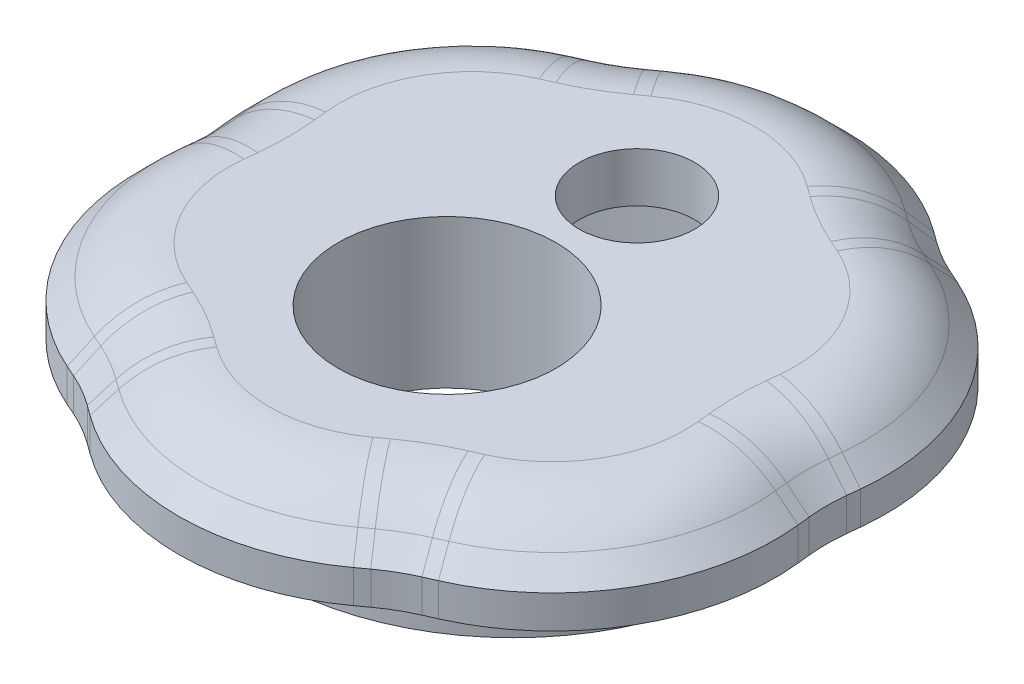
from build123d import *

# Parameters (mm, degrees)
EXTRUDE_1_DEPTH     = 3
CHAMFER_1_SIZE      = 4.5
SKETCH_3_R          = 14.75
SKETCH_3_R_2        = 14
EXTRUDE_2_DEPTH     = 6
FILLET_1_R          = 6
SKETCH_4_R          = 6.6
SKETCH_4_R_2        = 3.5
CUT_EXTRUDE_1_DEPTH = 10
SKETCH_5_R          = 7.5
SKETCH_5_R_2        = 6.6
EXTRUDE_3_DEPTH     = 6
EXTRUDE_4_DEPTH     = 2


with BuildPart() as part:
    # 草圖1 → 填料-伸長1 (new body)
    with BuildSketch(Plane(origin=(0, 0, 0), x_dir=(1, 0, 0), z_dir=(0, 1, 0))):
        with BuildLine():
            Line((-20.771924176, 1.723359404), (-20.69017274, 0.970783701))
            ThreePointArc((-20.69017274, 0.970783701), (-20.637537093, -0.00115824), (-20.69017274, -0.973100181))
            Line((-20.69017274, -0.973100181), (-20.771924176, -1.725675885))
            ThreePointArc((-20.771924176, -1.725675885), (-18.850031312, -10.84557912), (-11.912909862, -17.069938782))
            Line((-11.912909862, -17.069938782), (-11.220284466, -17.375427813))
            ThreePointArc((-11.220284466, -17.375427813), (-10.352240231, -17.815814976), (-9.536831642, -18.347369754))
            Line((-9.536831642, -18.347369754), (-8.925957683, -18.794456427))
            ThreePointArc((-8.925957683, -18.794456427), (-0.066943369, -21.69), (8.792070945, -18.794456427))
            Line((8.792070945, -18.794456427), (9.402944904, -18.347369754))
            ThreePointArc((9.402944904, -18.347369754), (10.218353493, -17.815814976), (11.086397728, -17.375427813))
            Line((11.086397728, -17.375427813), (11.779023124, -17.069938782))
            ThreePointArc((11.779023124, -17.069938782), (18.716144574, -10.84557912), (20.638037438, -1.725675885))
            Line((20.638037438, -1.725675885), (20.556286002, -0.973100181))
            ThreePointArc((20.556286002, -0.973100181), (20.503650354, -0.00115824), (20.556286002, 0.970783701))
            Line((20.556286002, 0.970783701), (20.638037438, 1.723359404))
            ThreePointArc((20.638037438, 1.723359404), (18.716144574, 10.84326264), (11.779023124, 17.067622301))
            Line((11.779023124, 17.067622301), (11.086397728, 17.373111332))
            ThreePointArc((11.086397728, 17.373111332), (10.218353493, 17.813498495), (9.402944904, 18.345053273))
            Line((9.402944904, 18.345053273), (8.792070945, 18.792139946))
            ThreePointArc((8.792070945, 18.792139946), (-0.066943369, 21.68768352), (-8.925957683, 18.792139946))
            Line((-8.925957683, 18.792139946), (-9.536831642, 18.345053273))
            ThreePointArc((-9.536831642, 18.345053273), (-10.352240231, 17.813498495), (-11.220284466, 17.373111332))
            Line((-11.220284466, 17.373111332), (-11.912909862, 17.067622301))
            ThreePointArc((-11.912909862, 17.067622301), (-18.850031312, 10.84326264), (-20.771924176, 1.723359404))
        make_face()
    extrude(amount=EXTRUDE_1_DEPTH)

    # 導角1
    # the kernel refuses this chamfer: 4.5 mm, written as the material it takes off along each edge
    with BuildSketch(Plane(origin=(-0.066943369, 3, -6.68768352), x_dir=(0.5906009542707505, 0, -0.8069637617727817), z_dir=(0.8069637617727817, 0, 0.5906009542707505))) as chamfer_1_piece_1:
        Polygon((15, -CHAMFER_1_SIZE), (15 - CHAMFER_1_SIZE, 0), (15, 0), align=None)
    revolve(axis=Axis((-0.066943369, 3, -6.68768352), (0, 1, 0)), revolution_arc=72.399330687, mode=Mode.SUBTRACT)
    with BuildSketch(Plane(origin=(-8.925957683, 3, -18.792139946), x_dir=(-0.01623909096472269, -0.9996219169112969, -0.022188176022919184), z_dir=(-0.8069637617727913, 0, 0.5906009542707374)), Plane(origin=(9.402944904, 3, -18.345053273), x_dir=(0.01623909096472324, -0.9996219169112966, -0.02218817602291905), z_dir=(-0.8069637617727801, 0, -0.590600954270753)), Plane(origin=(-11.220284466, 3, -17.373111332), x_dir=(-0.011095978617127454, -0.9996219169112966, -0.025157553321276054), z_dir=(-0.9149573107841873, 0, 0.4035506404933192)), Plane(origin=(11.779023124, 3, -17.067622301), x_dir=(0.011095978617127486, -0.9996219169112966, -0.02515755332127604), z_dir=(-0.9149573107841869, 0, -0.4035506404933204)), Plane(origin=(-20.771924176, 3, -1.723359404), x_dir=(-0.027335069581850155, -0.9996219169112966, 0.002969377298356594), z_dir=(0.10799354901139412, 0, 0.9941515947640599)), Plane(origin=(20.556286002, 3, -0.970783701), x_dir=(0.027335069581850155, -0.9996219169112966, 0.0029693772983568475), z_dir=(0.10799354901140323, 0, -0.994151594764059)), Plane(origin=(-20.69017274, 3, 0.973100181), x_dir=(-0.027335069581850155, -0.9996219169112966, -0.002969377298358358), z_dir=(-0.10799354901145754, 0, 0.994151594764053)), Plane(origin=(20.638037438, 3, 1.725675885), x_dir=(0.027335069581850155, -0.9996219169112966, -0.0029693772983564425), z_dir=(-0.10799354901138868, 0, -0.9941515947640606)), Plane(origin=(-11.912909862, 3, 17.069938782), x_dir=(-0.011095978617125555, -0.9996219169112966, 0.025157553321276813), z_dir=(0.9149573107842173, 0, 0.4035506404932512)), Plane(origin=(11.086397728, 3, 17.375427813), x_dir=(0.011095978617127088, -0.9996219169112966, 0.025157553321276047), z_dir=(0.9149573107841922, 0, -0.40355064049330813)), Plane(origin=(-9.536831642, 3, 18.347369754), x_dir=(-0.016239090964723223, -0.9996219169112966, 0.022188176022919063), z_dir=(0.8069637617727805, 0, 0.5906009542707523)), Plane(origin=(8.792070945, 3, 18.794456427), x_dir=(0.016239090964722667, -0.9996219169112969, 0.022188176022919195), z_dir=(0.8069637617727918, 0, -0.5906009542707369))) as chamfer_1_piece_2:
        Polygon((CHAMFER_1_SIZE * 0.999621916911, CHAMFER_1_SIZE * 0.0274958766106), (-CHAMFER_1_SIZE * 0.0274958766106, CHAMFER_1_SIZE * 0.999621916911), (0, 0), align=None)
    extrude(amount=0.757002964, mode=Mode.SUBTRACT)
    with BuildSketch(Plane(origin=(-14.852240231, 3, -25.607727129), x_dir=(0.5906009542707428, 0, 0.8069637617727874), z_dir=(0.8069637617727874, 0, -0.5906009542707428))) as chamfer_1_piece_3:
        Polygon((9, CHAMFER_1_SIZE), (9 + CHAMFER_1_SIZE, 0), (9, 0), align=None)
    revolve(axis=Axis((-14.852240231, 3, -25.607727129), (0, -1, 0)), revolution_arc=12.399330687, mode=Mode.SUBTRACT)
    with BuildSketch(Plane(origin=(14.718353493, 3, -25.607727129), x_dir=(-0.4035506404933155, 0, 0.9149573107841887), z_dir=(0.9149573107841887, 0, 0.4035506404933155))) as chamfer_1_piece_4:
        Polygon((9, CHAMFER_1_SIZE), (9 + CHAMFER_1_SIZE, 0), (9, 0), align=None)
    revolve(axis=Axis((14.718353493, 3, -25.607727129), (0, -1, 0)), revolution_arc=12.399330687, mode=Mode.SUBTRACT)
    with BuildSketch(Plane(origin=(-5.859650255, 3, -3.34326264), x_dir=(-0.4035506404933193, 0, -0.9149573107841873), z_dir=(0.9149573107841873, 0, -0.4035506404933193))) as chamfer_1_piece_5:
        Polygon((15, -CHAMFER_1_SIZE), (15 - CHAMFER_1_SIZE, 0), (15, 0), align=None)
    revolve(axis=Axis((-5.859650255, 3, -3.34326264), (0, 1, 0)), revolution_arc=72.399330687, mode=Mode.SUBTRACT)
    with BuildSketch(Plane(origin=(5.725763517, 3, -3.34326264), x_dir=(0.9941515947640591, 0, 0.10799354901140142), z_dir=(-0.10799354901140142, 0, 0.9941515947640591))) as chamfer_1_piece_6:
        Polygon((15, -CHAMFER_1_SIZE), (15 - CHAMFER_1_SIZE, 0), (15, 0), align=None)
    revolve(axis=Axis((5.725763517, 3, -3.34326264), (0, 1, 0)), revolution_arc=72.399330687, mode=Mode.SUBTRACT)
    with BuildSketch(Plane(origin=(-29.637537093, 3, 0.00115824), x_dir=(0.9941515947640589, 0, -0.10799354901140375), z_dir=(-0.10799354901140375, 0, -0.9941515947640589))) as chamfer_1_piece_7:
        Polygon((9, CHAMFER_1_SIZE), (9 + CHAMFER_1_SIZE, 0), (9, 0), align=None)
    revolve(axis=Axis((-29.637537093, 3, 0.00115824), (0, -1, 0)), revolution_arc=12.399330687, mode=Mode.SUBTRACT)
    with BuildSketch(Plane(origin=(29.503650354, 3, 0.00115824), x_dir=(-0.9941515947640608, 0, 0.1079935490113869), z_dir=(0.1079935490113869, 0, 0.9941515947640608))) as chamfer_1_piece_8:
        Polygon((9, CHAMFER_1_SIZE), (9 + CHAMFER_1_SIZE, 0), (9, 0), align=None)
    revolve(axis=Axis((29.503650354, 3, 0.00115824), (0, -1, 0)), revolution_arc=12.399330687, mode=Mode.SUBTRACT)
    with BuildSketch(Plane(origin=(-5.859650255, 3, 3.34557912), x_dir=(-0.994151594764053, 0, -0.10799354901145736), z_dir=(0.10799354901145736, 0, -0.994151594764053))) as chamfer_1_piece_9:
        Polygon((15, -CHAMFER_1_SIZE), (15 - CHAMFER_1_SIZE, 0), (15, 0), align=None)
    revolve(axis=Axis((-5.859650255, 3, 3.34557912), (0, 1, 0)), revolution_arc=72.399330687, mode=Mode.SUBTRACT)
    with BuildSketch(Plane(origin=(5.725763517, 3, 3.34557912), x_dir=(0.4035506404933145, 0, 0.9149573107841893), z_dir=(-0.9149573107841893, 0, 0.4035506404933145))) as chamfer_1_piece_10:
        Polygon((15, -CHAMFER_1_SIZE), (15 - CHAMFER_1_SIZE, 0), (15, 0), align=None)
    revolve(axis=Axis((5.725763517, 3, 3.34557912), (0, 1, 0)), revolution_arc=72.399330687, mode=Mode.SUBTRACT)
    with BuildSketch(Plane(origin=(-14.852240231, 3, 25.61004361), x_dir=(0.4035506404932408, 0, -0.9149573107842218), z_dir=(-0.9149573107842218, 0, -0.4035506404932408))) as chamfer_1_piece_11:
        Polygon((9, CHAMFER_1_SIZE), (9 + CHAMFER_1_SIZE, 0), (9, 0), align=None)
    revolve(axis=Axis((-14.852240231, 3, 25.61004361), (0, -1, 0)), revolution_arc=12.399330687, mode=Mode.SUBTRACT)
    with BuildSketch(Plane(origin=(14.718353493, 3, 25.61004361), x_dir=(-0.5906009542707262, 0, -0.8069637617727996), z_dir=(-0.8069637617727996, 0, 0.5906009542707262))) as chamfer_1_piece_12:
        Polygon((9, CHAMFER_1_SIZE), (9 + CHAMFER_1_SIZE, 0), (9, 0), align=None)
    revolve(axis=Axis((14.718353493, 3, 25.61004361), (0, -1, 0)), revolution_arc=12.399330687, mode=Mode.SUBTRACT)
    with BuildSketch(Plane(origin=(-0.066943369, 3, 6.69), x_dir=(-0.5906009542707477, 0, 0.8069637617727838), z_dir=(-0.8069637617727838, 0, -0.5906009542707477))) as chamfer_1_piece_13:
        Polygon((15, -CHAMFER_1_SIZE), (15 - CHAMFER_1_SIZE, 0), (15, 0), align=None)
    revolve(axis=Axis((-0.066943369, 3, 6.69), (0, 1, 0)), revolution_arc=72.399330687, mode=Mode.SUBTRACT)

    # 草圖3 → 填料-伸長2 (add)
    with BuildSketch(Plane.XZ):
        with Locations(Location((0, 0, 0), (0, 0, 90))):
            Circle(SKETCH_3_R)
        with Locations(Location((0, 0, 0), (0, 0, 270))):
            Circle(SKETCH_3_R_2, mode=Mode.SUBTRACT)
    extrude(amount=EXTRUDE_2_DEPTH)

    # 圓角1
    fillet_1_edges = [part.edges().sort_by_distance(p)[0] for p in [
        (-0.066943369, 3, 17.19),
        (6.43980363, 3, 14.939576162),
        (-6.573690369, 3, 14.939576162),
        (7.968353493, 3, 13.918700659),
        (-8.102240231, 3, 13.918700659),
        (9.616732544, 3, 13.105375399),
        (-9.750619282, 3, 13.105375399),
        (14.819030257, 3, 8.59557912),
        (-14.952916995, 3, 8.59557912),
        (16.123479543, 3, 1.835359004),
        (-16.257366282, 3, 1.835359004),
        (16.003650354, 3, 0.00115824),
        (-16.137537093, 3, 0.00115824),
        (16.123479543, 3, -1.833042523),
        (-16.257366282, 3, -1.833042523),
        (14.819030257, 3, -8.59326264),
        (-14.952916995, 3, -8.59326264),
        (9.616732544, 3, -13.103058918),
        (-9.750619282, 3, -13.103058918),
        (7.968353493, 3, -13.916384178),
        (-8.102240231, 3, -13.916384178),
        (6.43980363, 3, -14.937259682),
        (-6.573690369, 3, -14.937259682),
        (-0.066943369, 3, -17.18768352),
    ]]
    fillet(fillet_1_edges, radius=FILLET_1_R)

    # 草圖4 → 除料-伸長1 (cut)
    with BuildSketch(Plane(origin=(0, 3, 0), x_dir=(1, 0, 0), z_dir=(0, 1, 0))):
        with Locations(Location((0, -4, 0), (0, 0, 270))):
            Circle(SKETCH_4_R)
        with Locations(Location((0, 7.5, 0), (0, 0, 270))):
            Circle(SKETCH_4_R_2)
    extrude(amount=-CUT_EXTRUDE_1_DEPTH, mode=Mode.SUBTRACT)

    # 草圖5 → 填料-伸長3 (add)
    with BuildSketch(Plane.XZ):
        with Locations(Location((0, 4, 0), (0, 0, 90))):
            Circle(SKETCH_5_R)
        with Locations(Location((0, 4, 0), (0, 0, 90))):
            Circle(SKETCH_5_R_2, mode=Mode.SUBTRACT)
    extrude(amount=EXTRUDE_3_DEPTH)

    # 草圖6 → 填料-伸長4 (add)
    with BuildSketch(Plane.XZ):
        with BuildLine():
            Line((-8.650930211, -17.134607631), (-8.040056252, -17.581694303))
            ThreePointArc((-8.040056252, -17.581694303), (-0.066943369, -20.18768352), (7.906169514, -17.581694303))
            Line((7.906169514, -17.581694303), (8.517043473, -17.134607631))
            ThreePointArc((8.517043473, -17.134607631), (9.468353493, -16.51446039), (10.481071768, -16.000675366))
            Line((10.481071768, -16.000675366), (11.173697163, -15.695186335))
            ThreePointArc((11.173697163, -15.695186335), (17.417106468, -10.09326264), (19.146810046, -1.885349728))
            Line((19.146810046, -1.885349728), (19.065058609, -1.132774024))
            ThreePointArc((19.065058609, -1.132774024), (19.003650354, 0.00115824), (19.065058609, 1.135090505))
            Line((19.065058609, 1.135090505), (19.146810046, 1.887666208))
            ThreePointArc((19.146810046, 1.887666208), (17.417106468, 10.09557912), (11.173697163, 15.697502816))
            Line((11.173697163, 15.697502816), (10.481071768, 16.002991847))
            ThreePointArc((10.481071768, 16.002991847), (9.468353493, 16.51677687), (8.517043473, 17.136924111))
            Line((8.517043473, 17.136924111), (7.906169514, 17.584010784))
            ThreePointArc((7.906169514, 17.584010784), (-0.066943369, 20.19), (-8.040056252, 17.584010784))
            Line((-8.040056252, 17.584010784), (-8.650930211, 17.136924111))
            ThreePointArc((-8.650930211, 17.136924111), (-9.602240231, 16.51677687), (-10.614958506, 16.002991847))
            Line((-10.614958506, 16.002991847), (-11.307583902, 15.697502816))
            ThreePointArc((-11.307583902, 15.697502816), (-17.550993206, 10.09557912), (-19.280696784, 1.887666208))
            Line((-19.280696784, 1.887666208), (-19.198945348, 1.135090505))
            ThreePointArc((-19.198945348, 1.135090505), (-19.137537093, 0.00115824), (-19.198945348, -1.132774024))
            Line((-19.198945348, -1.132774024), (-19.280696784, -1.885349728))
            ThreePointArc((-19.280696784, -1.885349728), (-17.550993206, -10.09326264), (-11.307583902, -15.695186335))
            Line((-11.307583902, -15.695186335), (-10.614958506, -16.000675366))
            ThreePointArc((-10.614958506, -16.000675366), (-9.602240231, -16.51446039), (-8.650930211, -17.134607631))
        make_face()
        with BuildLine():
            Line((-8.060329257, -16.327643869), (-7.449455297, -16.774730542))
            ThreePointArc((-7.449455297, -16.774730542), (-0.066943369, -19.18768352), (7.315568559, -16.774730542))
            Line((7.315568559, -16.774730542), (7.926442519, -16.327643869))
            ThreePointArc((7.926442519, -16.327643869), (8.968353493, -15.648434986), (10.077521127, -15.085718055))
            Line((10.077521127, -15.085718055), (10.770146523, -14.780229024))
            ThreePointArc((10.770146523, -14.780229024), (16.551081064, -9.59326264), (18.152658451, -1.993343277))
            Line((18.152658451, -1.993343277), (18.070907015, -1.240767573))
            ThreePointArc((18.070907015, -1.240767573), (18.003650354, 0.00115824), (18.070907015, 1.243084054))
            Line((18.070907015, 1.243084054), (18.152658451, 1.995659757))
            ThreePointArc((18.152658451, 1.995659757), (16.551081064, 9.59557912), (10.770146523, 14.782545505))
            Line((10.770146523, 14.782545505), (10.077521127, 15.088034536))
            ThreePointArc((10.077521127, 15.088034536), (8.968353493, 15.650751466), (7.926442519, 16.329960349))
            Line((7.926442519, 16.329960349), (7.315568559, 16.777047022))
            ThreePointArc((7.315568559, 16.777047022), (-0.066943369, 19.19), (-7.449455297, 16.777047022))
            Line((-7.449455297, 16.777047022), (-8.060329257, 16.329960349))
            ThreePointArc((-8.060329257, 16.329960349), (-9.102240231, 15.650751466), (-10.211407865, 15.088034536))
            Line((-10.211407865, 15.088034536), (-10.904033261, 14.782545505))
            ThreePointArc((-10.904033261, 14.782545505), (-16.684967802, 9.59557912), (-18.286545189, 1.995659757))
            Line((-18.286545189, 1.995659757), (-18.204793753, 1.243084054))
            ThreePointArc((-18.204793753, 1.243084054), (-18.137537093, 0.00115824), (-18.204793753, -1.240767573))
            Line((-18.204793753, -1.240767573), (-18.286545189, -1.993343277))
            ThreePointArc((-18.286545189, -1.993343277), (-16.684967802, -9.59326264), (-10.904033261, -14.780229024))
            Line((-10.904033261, -14.780229024), (-10.211407865, -15.085718055))
            ThreePointArc((-10.211407865, -15.085718055), (-9.102240231, -15.648434986), (-8.060329257, -16.327643869))
        make_face(mode=Mode.SUBTRACT)
    extrude(amount=EXTRUDE_4_DEPTH)


solid = part.part
